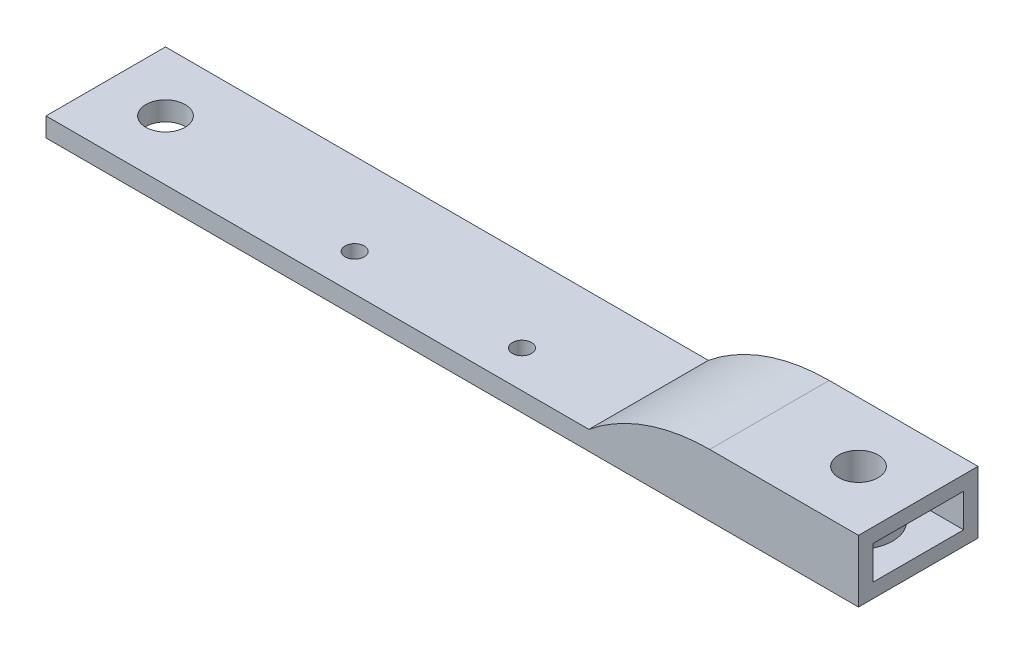
from build123d import *

# Parameters (mm, degrees)
SKETCH1_W           = 170
SKETCH1_H           = 25
SKETCH1_R           = 2
SKETCH1_R_2         = 4.125
BOSS_EXTRUDE1_DEPTH = 4
SKETCH2_R           = 4.125
CUT_EXTRUDE1_DEPTH  = 87.007267135
SKETCH3_W           = 56.414472257
SKETCH3_H           = 25
SKETCH3_R           = 4.125
BOSS_EXTRUDE2_DEPTH = 9
FILLET1_R           = 40
SHELL2_T            = -3


with BuildPart() as part:
    # Sketch1 → Boss-Extrude1 (new body)
    with BuildSketch(Plane(origin=(0, 0, 0), x_dir=(1, 0, 0), z_dir=(0, 1, 0))):
        Rectangle(SKETCH1_W, SKETCH1_H)
        with Locations(Location((-28.158485727, -4.763382536, 0), (0, 0, 270))):
            Circle(SKETCH1_R, mode=Mode.SUBTRACT)
        with Locations(Location((6.841514273, -4.763382536, 0), (0, 0, 270))):
            Circle(SKETCH1_R, mode=Mode.SUBTRACT)
        with Locations(Location((72.5, 0, 0), (0, 0, 270))):
            Circle(SKETCH1_R_2, mode=Mode.SUBTRACT)
    extrude(amount=BOSS_EXTRUDE1_DEPTH)

    # Sketch2 → Cut-Extrude1 (cut, through all)
    with BuildSketch(Plane(origin=(0, 4, 0), x_dir=(1, 0, 0), z_dir=(0, 1, 0))):
        with Locations(Location((-72.5, 0, 0), (0, 0, 270))):
            Circle(SKETCH2_R)
    extrude(amount=-CUT_EXTRUDE1_DEPTH, mode=Mode.SUBTRACT)

    # Sketch3 → Boss-Extrude2 (add)
    with BuildSketch(Plane(origin=(0, 4, 0), x_dir=(1, 0, 0), z_dir=(0, 1, 0))):
        with Locations((56.792763872, 0)):
            Rectangle(SKETCH3_W, SKETCH3_H)
        with Locations(Location((72.5, 0, 0), (0, 0, 270))):
            Circle(SKETCH3_R, mode=Mode.SUBTRACT)
    extrude(amount=BOSS_EXTRUDE2_DEPTH)

    # Fillet1
    # the kernel refuses this fillet: 40 mm, written as the material it takes off along each edge
    with BuildSketch(Plane(origin=(28.585527743, 13, -75.696123299), x_dir=(1, 0, 0), z_dir=(0, 0, 1))) as fillet1_piece_1:
        with BuildLine():
            CenterArc((25.27844932, -40), FILLET1_R, 90, 39.194967426)
            Line((0, -9), (0, 0))
            Line((0, 0), (25.27844932, 0))
        make_face()
    extrude(amount=151.392246598, mode=Mode.SUBTRACT)

    # Shell2
    shell2_openings = [part.faces().sort_by_distance(p)[0] for p in [
        (85, 6.5, 0),
    ]]
    offset(amount=SHELL2_T, openings=shell2_openings)


solid = part.part
